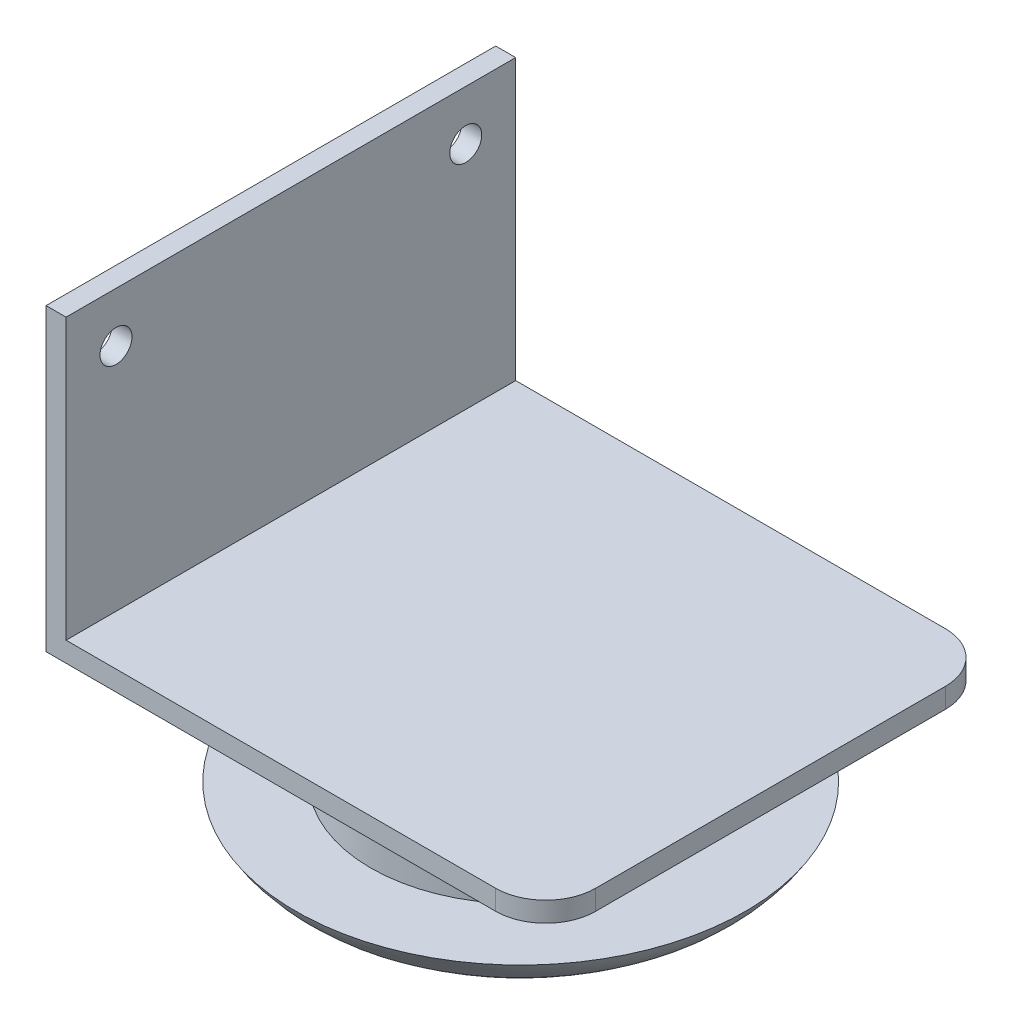
from build123d import *

# Parameters (mm, degrees)
EXTRUDE_1_DEPTH     = 45
SKETCH_2_R          = 1.6
CUT_EXTRUDE_1_DEPTH = 35
FILLET_1_R          = 5
SKETCH_3_R          = 15
EXTRUDE_2_DEPTH     = 10
SKETCH_7_R          = 22.5
EXTRUDE_3_DEPTH     = 5
FILLET_2_R          = 10


with BuildPart() as part:
    # ｽｹｯﾁ1 → ﾎﾞｽ - 押し出し1 (new body)
    with BuildSketch(Plane.XY):
        Polygon((0, 30), (0, 0), (50, 0), (50, 2), (2, 2), (2, 30), align=None)
    extrude(amount=EXTRUDE_1_DEPTH)

    # ｽｹｯﾁ2 → ｶｯﾄ - 押し出し1 (cut)
    with BuildSketch(Plane.ZY):
        with Locations((40, 25)):
            Circle(SKETCH_2_R)
        with Locations((5, 25)):
            Circle(SKETCH_2_R)
    extrude(amount=-CUT_EXTRUDE_1_DEPTH, mode=Mode.SUBTRACT)

    # ﾌｨﾚｯﾄ1
    fillet_1_edges = [part.edges().sort_by_distance(p)[0] for p in [
        (50, 1, 45),
        (50, 1, 0),
    ]]
    fillet(fillet_1_edges, radius=FILLET_1_R)

    # ｽｹｯﾁ3 → ﾎﾞｽ - 押し出し2 (add)
    with BuildSketch(Plane.XZ):
        with Locations(Location((25, 22.5, 0), (0, 0, 90))):
            Circle(SKETCH_3_R)
    extrude(amount=EXTRUDE_2_DEPTH)

    # ｽｹｯﾁ7 → ﾎﾞｽ - 押し出し3 (add)
    with BuildSketch(Plane(origin=(0, -10, 0), x_dir=(-1, 0, 0), z_dir=(0, -1, 0))):
        with Locations(Location((-25, -22.5, 0), (0, 0, 90))):
            Circle(SKETCH_7_R)
    extrude(amount=EXTRUDE_3_DEPTH)

    # ﾌｨﾚｯﾄ2
    # the kernel refuses this fillet: 10 mm, written as the material it takes off along each edge
    with BuildSketch(Plane(origin=(25, -15, 22.5), x_dir=(0, 0, -1), z_dir=(-1, 0, 0))) as fillet_2_piece_1:
        with BuildLine():
            CenterArc((13.839745962, -10), FILLET_2_R, 30, 60)
            Line((13.839745962, 0), (13.839745962, 0.2))
            Line((13.839745962, 0.2), (22.5, 0.2))
            Line((22.5, 0.2), (22.7, 0))
            ThreePointArc((22.7, 0), (22.7, -2.5), (22.673205081, -4.9))
            Line((22.673205081, -4.9), (22.5, -5))
        make_face()
    revolve(axis=Axis((25, -15, 22.5), (0, -1, 0)), mode=Mode.SUBTRACT)


solid = part.part
